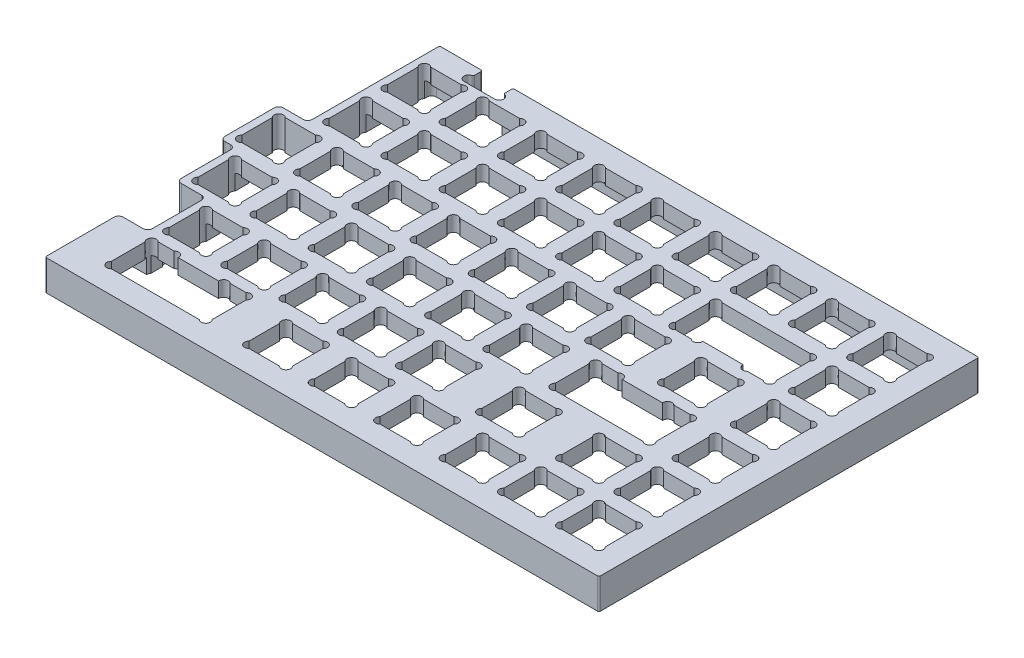
from build123d import *

# Parameters (mm, degrees)
PLATE_FRAME_DEPTH         = 5
CUT_EXTRUDE_1U_DEPTH      = 224.745817
F_2U_BACKSPACE_DEPTH      = 224.745817
ENTERANDSPACE_DEPTH       = 224.745817
LIP_DEPTH                 = 5
USB_SLOT_DEPTH            = 224.913355173
SKETCH10_R                = 1.5
CUT_EXTRUDE1_DEPTH        = 224.745817
FILLET2_R                 = 1.5
FILLET3_R                 = 0.5
M2X0_4_TAPPED_HOLE1_D     = 1.6
M2X0_4_TAPPED_HOLE1_DEPTH = 5.2
M2X0_4_TAPPED_HOLE1_TIP   = 0.480688495


with BuildPart() as part:
    # Sketch1 → Plate Frame (new body)
    with BuildSketch(Plane(origin=(0, 0, 0), x_dir=(1, 0, 0), z_dir=(0, 1, 0))):
        Polygon((0, 0), (0, 124.3), (-176.45, 124.3), (-176.45, 81.2), (-185.975, 81.2), (-185.975, 62.15), (-181.2125, 62.15), (-181.2125, 43.1), (-171.6875, 43.1), (-171.6875, 24.05), (-181.2125, 24.05), (-181.2125, 0), align=None)
    extrude(amount=PLATE_FRAME_DEPTH)

    # Sketch3 → Cut-Extrude 1U (cut, through all)
    with BuildSketch(Plane(origin=(0, 5, 0), x_dir=(1, 0, 0), z_dir=(0, 1, 0))):
        with BuildLine():
            Line((-21.625, 19.503679656), (-21.625, 9.546320344))
            ThreePointArc((-21.625, 9.546320344), (-21.625, 7.425), (-19.503679656, 7.425))
            Line((-19.503679656, 7.425), (-9.546320344, 7.425))
            ThreePointArc((-9.546320344, 7.425), (-7.425, 7.425), (-7.425, 9.546320344))
            Line((-7.425, 9.546320344), (-7.425, 19.503679656))
            ThreePointArc((-7.425, 19.503679656), (-7.425, 21.625), (-9.546320344, 21.625))
            Line((-9.546320344, 21.625), (-19.503679656, 21.625))
            ThreePointArc((-19.503679656, 21.625), (-21.625, 21.625), (-21.625, 19.503679656))
        make_face()
    cut_extrude_1u = extrude(amount=-CUT_EXTRUDE_1U_DEPTH, mode=Mode.SUBTRACT)

    # Sketch-Pattern1: Cut-Extrude 1U at 45 more places
    with Locations((0, 0, -19.05), (0, 0, -38.1), (0, 0, -57.15), (0, 0, -76.2), (0, 0, -95.25), (-19.05, 0, 0), (-38.1, 0, 0), (-19.05, 0, -19.05), (-19.05, 0, -95.25), (-38.1, 0, -95.25), (-57.15, 0, -95.25), (-76.2, 0, -95.25), (-95.25, 0, -95.25), (-114.3, 0, -95.25), (-133.35, 0, -95.25), (-152.4, 0, -95.25), (-152.4, 0, -76.2), (-133.35, 0, -76.2), (-114.3, 0, -76.2), (-95.25, 0, -76.2), (-76.2, 0, -76.2), (-57.15, 0, -76.2), (-161.925, 0, -57.15), (-142.875, 0, -57.15), (-123.825, 0, -57.15), (-104.775, 0, -57.15), (-85.725, 0, -57.15), (-66.675, 0, -57.15), (-47.625, 0, -57.15), (-138.1125, 0, -38.1), (-157.1625, 0, -38.1), (-119.0625, 0, -38.1), (-100.0125, 0, -38.1), (-80.9625, 0, -38.1), (-61.9125, 0, -38.1), (-128.5875, 0, -19.05), (-147.6375, 0, -19.05), (-109.5375, 0, -19.05), (-90.4875, 0, -19.05), (-71.4375, 0, -19.05), (-59.53125, 0, 0), (-80.9625, 0, 0), (-102.39375, 0, 0), (-45.24375, 0, -19.05), (-23.8125, 0, -57.15)):
        add(cut_extrude_1u, mode=Mode.SUBTRACT)

    # Sketch4 → 2U-Backspace (cut, through all)
    with BuildSketch(Plane(origin=(0, 5, 0), x_dir=(1, 0, 0), z_dir=(0, 1, 0))):
        with BuildLine():
            Line((-57.478679656, 97.775), (-28.721320344, 97.775))
            ThreePointArc((-28.721320344, 97.775), (-26.6, 97.775), (-26.6, 95.653679656))
            Line((-26.6, 95.653679656), (-26.6, 84.596320344))
            ThreePointArc((-26.6, 84.596320344), (-26.6, 82.475), (-28.721320344, 82.475))
            Line((-28.721320344, 82.475), (-33.928679656, 82.475))
            ThreePointArc((-33.928679656, 82.475), (-35.627180431, 82.178030117), (-36.482853943, 83.675))
            Line((-36.482853943, 83.675), (-49.717146057, 83.675))
            ThreePointArc((-49.717146057, 83.675), (-50.572819569, 82.178030117), (-52.271320344, 82.475))
            Line((-52.271320344, 82.475), (-57.478679656, 82.475))
            ThreePointArc((-57.478679656, 82.475), (-59.6, 82.475), (-59.6, 84.596320344))
            Line((-59.6, 84.596320344), (-59.6, 95.653679656))
            ThreePointArc((-59.6, 95.653679656), (-59.6, 97.775), (-57.478679656, 97.775))
        make_face()
    extrude(amount=-F_2U_BACKSPACE_DEPTH, mode=Mode.SUBTRACT)

    # Sketch6 → EnterAndSpace (cut, through all)
    with BuildSketch(Plane(origin=(0, 5, 0), x_dir=(1, 0, 0), z_dir=(0, 1, 0))):
        with BuildLine():
            Line((-169.1375, 20.653679656), (-169.1375, 9.596320344))
            ThreePointArc((-169.1375, 9.596320344), (-169.1375, 7.475), (-167.016179656, 7.475))
            Line((-167.016179656, 7.475), (-138.258820344, 7.475))
            ThreePointArc((-138.258820344, 7.475), (-136.1375, 7.475), (-136.1375, 9.596320344))
            Line((-136.1375, 9.596320344), (-136.1375, 20.653679656))
            ThreePointArc((-136.1375, 20.653679656), (-136.1375, 22.775), (-138.258820344, 22.775))
            Line((-138.258820344, 22.775), (-143.466179656, 22.775))
            ThreePointArc((-143.466179656, 22.775), (-145.164680431, 23.071969883), (-146.020353943, 21.575))
            Line((-146.020353943, 21.575), (-159.254646057, 21.575))
            ThreePointArc((-159.254646057, 21.575), (-160.110319569, 23.071969883), (-161.808820344, 22.775))
            Line((-161.808820344, 22.775), (-167.016179656, 22.775))
            ThreePointArc((-167.016179656, 22.775), (-169.1375, 22.775), (-169.1375, 20.653679656))
        make_face()
        with BuildLine():
            Line((-61.98125, 58.753679656), (-61.98125, 47.696320344))
            ThreePointArc((-61.98125, 47.696320344), (-61.98125, 45.575), (-59.859929656, 45.575))
            Line((-59.859929656, 45.575), (-31.102570344, 45.575))
            ThreePointArc((-31.102570344, 45.575), (-28.98125, 45.575), (-28.98125, 47.696320344))
            Line((-28.98125, 47.696320344), (-28.98125, 58.753679656))
            ThreePointArc((-28.98125, 58.753679656), (-28.98125, 60.875), (-31.102570344, 60.875))
            Line((-31.102570344, 60.875), (-36.309929656, 60.875))
            ThreePointArc((-36.309929656, 60.875), (-38.008430431, 61.171969883), (-38.864103943, 59.675))
            Line((-38.864103943, 59.675), (-52.098396057, 59.675))
            ThreePointArc((-52.098396057, 59.675), (-52.954069569, 61.171969883), (-54.652570344, 60.875))
            Line((-54.652570344, 60.875), (-59.859929656, 60.875))
            ThreePointArc((-59.859929656, 60.875), (-61.98125, 60.875), (-61.98125, 58.753679656))
        make_face()
    extrude(amount=-ENTERANDSPACE_DEPTH, mode=Mode.SUBTRACT)

    # Sketch8 → Lip (add)
    with BuildSketch(Plane.XZ):
        Polygon((-181.2125, 0), (0, 0), (0, -124.3), (-176.45, -124.3), (-176.45, -81.2), (-185.975, -81.2), (-185.975, -62.15), (-181.2125, -62.15), (-181.2125, -43.1), (-171.6875, -43.1), (-171.6875, -24.05), (-181.2125, -24.05), align=None)
        Polygon((-178.7875, -5), (-5, -5), (-5, -119.3), (-174.025, -119.3), (-174.025, -78.775), (-183.55, -78.775), (-183.55, -64.575), (-178.7875, -64.575), (-178.7875, -45.525), (-169.2625, -45.525), (-169.2625, -21.575), (-178.7875, -21.575), align=None, mode=Mode.SUBTRACT)
    extrude(amount=LIP_DEPTH)

    # Sketch11 → USB-Slot (cut, through all)
    with BuildSketch(Plane(origin=(0, 5, 0), x_dir=(1, 0, 0), z_dir=(0, 1, 0))):
        with BuildLine():
            Line((-162.425, 121.275), (-162.425, 124.3))
            Line((-162.425, 124.3), (-152.425, 124.3))
            Line((-152.425, 124.3), (-152.425, 121.275))
            ThreePointArc((-152.425, 121.275), (-150.925, 119.775), (-152.425, 118.275))
            Line((-152.425, 118.275), (-162.425, 118.275))
            ThreePointArc((-162.425, 118.275), (-163.925, 119.775), (-162.425, 121.275))
        make_face()
    extrude(amount=-USB_SLOT_DEPTH, mode=Mode.SUBTRACT)

    # Sketch10 → Cut-Extrude1 (cut, through all)
    with BuildSketch(Plane(origin=(0, 0, 0), x_dir=(1, 0, 0), z_dir=(0, 1, 0))):
        with Locations((-172.964339828, 115.814339828)):
            Circle(SKETCH10_R)
        with Locations((-172.964339828, 103.735660172)):
            Circle(SKETCH10_R)
        with Locations((-172.964339828, 96.764339828)):
            Circle(SKETCH10_R)
        with Locations((-172.964339828, 84.685660172)):
            Circle(SKETCH10_R)
        with Locations((-182.489339828, 77.714339828)):
            Circle(SKETCH10_R)
        with Locations((-182.489339828, 65.635660172)):
            Circle(SKETCH10_R)
        with Locations((-177.726839828, 58.664339828)):
            Circle(SKETCH10_R)
        with Locations((-177.726839828, 46.585660172)):
            Circle(SKETCH10_R)
        with Locations((-168.201839828, 39.614339828)):
            Circle(SKETCH10_R)
        with Locations((-168.201839828, 27.535660172)):
            Circle(SKETCH10_R)
        with Locations((-168.076839828, 21.714339828)):
            Circle(SKETCH10_R)
    extrude(amount=-CUT_EXTRUDE1_DEPTH, mode=Mode.SUBTRACT)

    # Fillet2
    fillet2_edges = [part.edges().sort_by_distance(p)[0] for p in [
        (-178.7875, -2.5, -21.575),
        (-174.025, -2.5, -119.3),
        (-5, -2.5, -119.3),
        (-5, -2.5, -5),
        (-178.7875, -2.5, -5),
        (-181.2125, 0, -24.05),
        (-171.6875, 0, -24.05),
        (-171.6875, 0, -43.1),
        (-181.2125, 0, -43.1),
        (-181.2125, 0, -62.15),
        (-185.975, 0, -62.15),
        (-185.975, 0, -81.2),
        (-176.45, 0, -81.2),
    ]]
    fillet(fillet2_edges, radius=FILLET2_R)

    # Fillet3
    fillet3_edges = [part.edges().sort_by_distance(p)[0] for p in [
        (-169.2625, -2.5, -45.525),
        (-178.7875, -2.5, -64.575),
        (-174.025, -2.5, -78.775),
        (-152.425, 0, -121.275),
        (-162.425, 0, -124.3),
        (-152.425, 0, -124.3),
        (-162.425, 0, -121.275),
        (-181.2125, 0, 0),
        (-176.45, 0, -124.3),
        (0, 0, -124.3),
        (0, 0, 0),
    ]]
    fillet(fillet3_edges, radius=FILLET3_R)

    # M2x0.4 Tapped Hole1
    with Locations(Plane(origin=(0, -5, 0), x_dir=(-1, 0, 0), z_dir=(0, -1, 0))):
        with Locations((173.95, 121.8), (88.225, 121.8), (2.5, 121.8), (2.5, 62.15), (2.5, 2.5), (90.60625, 2.5), (178.7125, 2.5)):
            Hole(M2X0_4_TAPPED_HOLE1_D / 2, depth=M2X0_4_TAPPED_HOLE1_DEPTH)
            with Locations((0, 0, -(M2X0_4_TAPPED_HOLE1_DEPTH + M2X0_4_TAPPED_HOLE1_TIP / 2))):  # 118° drill point
                Cone(0, M2X0_4_TAPPED_HOLE1_D / 2, M2X0_4_TAPPED_HOLE1_TIP, mode=Mode.SUBTRACT)


solid = part.part
